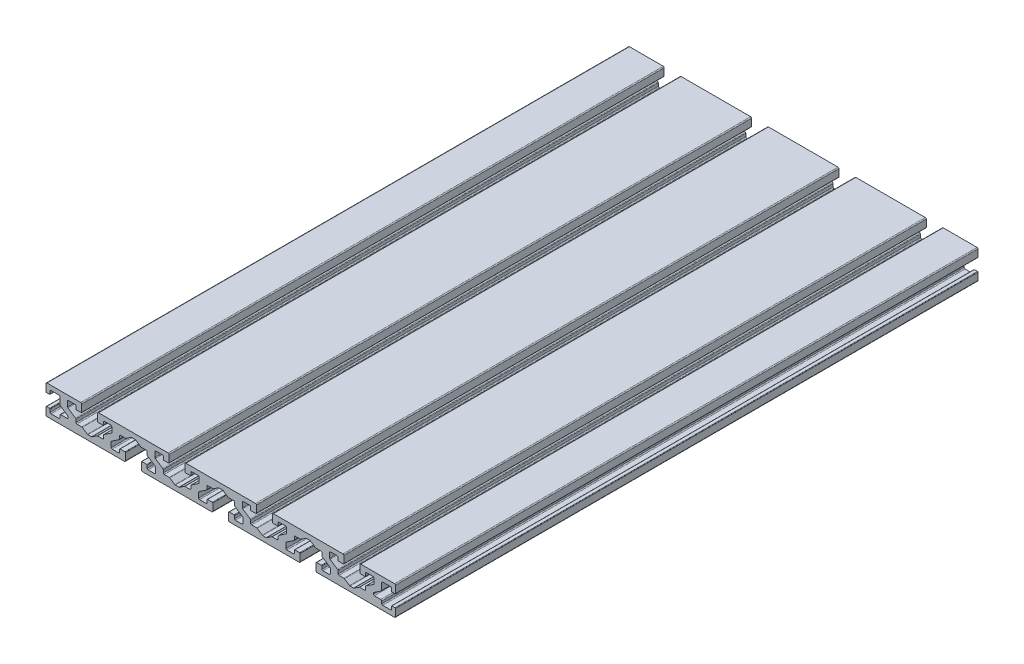
from build123d import *

# Parameters (mm, degrees)
BOSS_EXTRUDE1_DEPTH = 300


with BuildPart() as part:
    # Sketch1 → Boss-Extrude1 (new body)
    with BuildSketch(Plane.XY):
        with BuildLine():
            Line((0.5, 0), (40.4, 0))
            ThreePointArc((40.4, 0), (40.753553391, 0.146446609), (40.9, 0.5))
            Line((40.9, 0.5), (40.9, 4.15))
            ThreePointArc((40.9, 4.15), (40.826776695, 4.326776695), (40.65, 4.4))
            Line((40.65, 4.4), (38.15, 4.4))
            ThreePointArc((38.15, 4.4), (37.973223305, 4.326776695), (37.9, 4.15))
            Line((37.9, 4.15), (37.9, 2.8))
            ThreePointArc((37.9, 2.8), (37.753553391, 2.446446609), (37.4, 2.3))
            Line((37.4, 2.3), (34.1, 2.3))
            ThreePointArc((34.1, 2.3), (33.746446609, 2.446446609), (33.6, 2.8))
            Line((33.6, 2.8), (33.6, 5.329632483))
            ThreePointArc((33.6, 5.329632483), (33.659162701, 5.565561446), (33.822649902, 5.74565763))
            Line((33.822649902, 5.74565763), (37.677350098, 8.315457761))
            ThreePointArc((37.677350098, 8.315457761), (37.840837299, 8.495553945), (37.9, 8.731482908))
            Line((37.9, 8.731482908), (37.9, 10.1))
            ThreePointArc((37.9, 10.1), (38.046446609, 10.453553391), (38.4, 10.6))
            Line((38.4, 10.6), (40.952775638, 10.6))
            ThreePointArc((40.952775638, 10.6), (41.097667712, 10.621453987), (41.230125736, 10.683974853))
            Line((41.230125736, 10.683974853), (43.828201177, 12.416025147))
            ThreePointArc((43.828201177, 12.416025147), (43.960659201, 12.478546013), (44.105551275, 12.5))
            Line((44.105551275, 12.5), (45.894448725, 12.5))
            ThreePointArc((45.894448725, 12.5), (46.039340799, 12.478546013), (46.171798823, 12.416025147))
            Line((46.171798823, 12.416025147), (48.769874264, 10.683974853))
            ThreePointArc((48.769874264, 10.683974853), (48.902332288, 10.621453987), (49.047224362, 10.6))
            Line((49.047224362, 10.6), (51.6, 10.6))
            ThreePointArc((51.6, 10.6), (51.953553391, 10.453553391), (52.1, 10.1))
            Line((52.1, 10.1), (52.1, 8.731482908))
            ThreePointArc((52.1, 8.731482908), (52.159162701, 8.495553945), (52.322649902, 8.315457761))
            Line((52.322649902, 8.315457761), (56.177350098, 5.74565763))
            ThreePointArc((56.177350098, 5.74565763), (56.340837299, 5.565561446), (56.4, 5.329632483))
            Line((56.4, 5.329632483), (56.4, 2.8))
            ThreePointArc((56.4, 2.8), (56.253553391, 2.446446609), (55.9, 2.3))
            Line((55.9, 2.3), (52.6, 2.3))
            ThreePointArc((52.6, 2.3), (52.246446609, 2.446446609), (52.1, 2.8))
            Line((52.1, 2.8), (52.1, 4.15))
            ThreePointArc((52.1, 4.15), (52.026776695, 4.326776695), (51.85, 4.4))
            Line((51.85, 4.4), (49.35, 4.4))
            ThreePointArc((49.35, 4.4), (49.173223305, 4.326776695), (49.1, 4.15))
            Line((49.1, 4.15), (49.1, 0.5))
            ThreePointArc((49.1, 0.5), (49.246446609, 0.146446609), (49.6, 0))
            Line((49.6, 0), (85.4, 0))
            ThreePointArc((85.4, 0), (85.753553391, 0.146446609), (85.9, 0.5))
            Line((85.9, 0.5), (85.9, 4.15))
            ThreePointArc((85.9, 4.15), (85.826776695, 4.326776695), (85.65, 4.4))
            Line((85.65, 4.4), (83.15, 4.4))
            ThreePointArc((83.15, 4.4), (82.973223305, 4.326776695), (82.9, 4.15))
            Line((82.9, 4.15), (82.9, 2.8))
            ThreePointArc((82.9, 2.8), (82.753553391, 2.446446609), (82.4, 2.3))
            Line((82.4, 2.3), (79.1, 2.3))
            ThreePointArc((79.1, 2.3), (78.746446609, 2.446446609), (78.6, 2.8))
            Line((78.6, 2.8), (78.6, 5.329632483))
            ThreePointArc((78.6, 5.329632483), (78.659162701, 5.565561446), (78.822649902, 5.74565763))
            Line((78.822649902, 5.74565763), (82.677350098, 8.315457761))
            ThreePointArc((82.677350098, 8.315457761), (82.840837299, 8.495553945), (82.9, 8.731482908))
            Line((82.9, 8.731482908), (82.9, 10.1))
            ThreePointArc((82.9, 10.1), (83.046446609, 10.453553391), (83.4, 10.6))
            Line((83.4, 10.6), (85.952775638, 10.6))
            ThreePointArc((85.952775638, 10.6), (86.097667712, 10.621453987), (86.230125736, 10.683974853))
            Line((86.230125736, 10.683974853), (88.828201177, 12.416025147))
            ThreePointArc((88.828201177, 12.416025147), (88.960659201, 12.478546013), (89.105551275, 12.5))
            Line((89.105551275, 12.5), (90.894448725, 12.5))
            ThreePointArc((90.894448725, 12.5), (91.039340799, 12.478546013), (91.171798823, 12.416025147))
            Line((91.171798823, 12.416025147), (93.769874264, 10.683974853))
            ThreePointArc((93.769874264, 10.683974853), (93.902332288, 10.621453987), (94.047224362, 10.6))
            Line((94.047224362, 10.6), (96.6, 10.6))
            ThreePointArc((96.6, 10.6), (96.953553391, 10.453553391), (97.1, 10.1))
            Line((97.1, 10.1), (97.1, 8.731482908))
            ThreePointArc((97.1, 8.731482908), (97.159162701, 8.495553945), (97.322649902, 8.315457761))
            Line((97.322649902, 8.315457761), (101.177350098, 5.74565763))
            ThreePointArc((101.177350098, 5.74565763), (101.340837299, 5.565561446), (101.4, 5.329632483))
            Line((101.4, 5.329632483), (101.4, 2.8))
            ThreePointArc((101.4, 2.8), (101.253553391, 2.446446609), (100.9, 2.3))
            Line((100.9, 2.3), (97.6, 2.3))
            ThreePointArc((97.6, 2.3), (97.246446609, 2.446446609), (97.1, 2.8))
            Line((97.1, 2.8), (97.1, 4.15))
            ThreePointArc((97.1, 4.15), (97.026776695, 4.326776695), (96.85, 4.4))
            Line((96.85, 4.4), (94.35, 4.4))
            ThreePointArc((94.35, 4.4), (94.173223305, 4.326776695), (94.1, 4.15))
            Line((94.1, 4.15), (94.1, 0.5))
            ThreePointArc((94.1, 0.5), (94.246446609, 0.146446609), (94.6, 0))
            Line((94.6, 0), (130.4, 0))
            ThreePointArc((130.4, 0), (130.753553391, 0.146446609), (130.9, 0.5))
            Line((130.9, 0.5), (130.9, 4.15))
            ThreePointArc((130.9, 4.15), (130.826776695, 4.326776695), (130.65, 4.4))
            Line((130.65, 4.4), (128.15, 4.4))
            ThreePointArc((128.15, 4.4), (127.973223305, 4.326776695), (127.9, 4.15))
            Line((127.9, 4.15), (127.9, 2.8))
            ThreePointArc((127.9, 2.8), (127.753553391, 2.446446609), (127.4, 2.3))
            Line((127.4, 2.3), (124.1, 2.3))
            ThreePointArc((124.1, 2.3), (123.746446609, 2.446446609), (123.6, 2.8))
            Line((123.6, 2.8), (123.6, 5.329632483))
            ThreePointArc((123.6, 5.329632483), (123.659162701, 5.565561446), (123.822649902, 5.74565763))
            Line((123.822649902, 5.74565763), (127.677350098, 8.315457761))
            ThreePointArc((127.677350098, 8.315457761), (127.840837299, 8.495553945), (127.9, 8.731482908))
            Line((127.9, 8.731482908), (127.9, 10.1))
            ThreePointArc((127.9, 10.1), (128.046446609, 10.453553391), (128.4, 10.6))
            Line((128.4, 10.6), (130.952775638, 10.6))
            ThreePointArc((130.952775638, 10.6), (131.097667712, 10.621453987), (131.230125736, 10.683974853))
            Line((131.230125736, 10.683974853), (133.828201177, 12.416025147))
            ThreePointArc((133.828201177, 12.416025147), (133.960659201, 12.478546013), (134.105551275, 12.5))
            Line((134.105551275, 12.5), (135.894448725, 12.5))
            ThreePointArc((135.894448725, 12.5), (136.039340799, 12.478546013), (136.171798823, 12.416025147))
            Line((136.171798823, 12.416025147), (138.769874264, 10.683974853))
            ThreePointArc((138.769874264, 10.683974853), (138.902332288, 10.621453987), (139.047224362, 10.6))
            Line((139.047224362, 10.6), (141.6, 10.6))
            ThreePointArc((141.6, 10.6), (141.953553391, 10.453553391), (142.1, 10.1))
            Line((142.1, 10.1), (142.1, 8.731482908))
            ThreePointArc((142.1, 8.731482908), (142.159162701, 8.495553945), (142.322649902, 8.315457761))
            Line((142.322649902, 8.315457761), (146.177350098, 5.74565763))
            ThreePointArc((146.177350098, 5.74565763), (146.340837299, 5.565561446), (146.4, 5.329632483))
            Line((146.4, 5.329632483), (146.4, 2.8))
            ThreePointArc((146.4, 2.8), (146.253553391, 2.446446609), (145.9, 2.3))
            Line((145.9, 2.3), (142.6, 2.3))
            ThreePointArc((142.6, 2.3), (142.246446609, 2.446446609), (142.1, 2.8))
            Line((142.1, 2.8), (142.1, 4.15))
            ThreePointArc((142.1, 4.15), (142.026776695, 4.326776695), (141.85, 4.4))
            Line((141.85, 4.4), (139.35, 4.4))
            ThreePointArc((139.35, 4.4), (139.173223305, 4.326776695), (139.1, 4.15))
            Line((139.1, 4.15), (139.1, 0.5))
            ThreePointArc((139.1, 0.5), (139.246446609, 0.146446609), (139.6, 0))
            Line((139.6, 0), (179.5, 0))
            ThreePointArc((179.5, 0), (179.853553391, 0.146446609), (180, 0.5))
            Line((180, 0.5), (180, 4.15))
            ThreePointArc((180, 4.15), (179.926776695, 4.326776695), (179.75, 4.4))
            Line((179.75, 4.4), (178.15, 4.4))
            ThreePointArc((178.15, 4.4), (177.973223305, 4.326776695), (177.9, 4.15))
            Line((177.9, 4.15), (177.9, 2.8))
            ThreePointArc((177.9, 2.8), (177.753553391, 2.446446609), (177.4, 2.3))
            Line((177.4, 2.3), (173.4, 2.3))
            ThreePointArc((173.4, 2.3), (173.046446609, 2.446446609), (172.9, 2.8))
            Line((172.9, 2.8), (172.9, 3.9))
            ThreePointArc((172.9, 3.9), (172.753553391, 4.253553391), (172.4, 4.4))
            Line((172.4, 4.4), (169.1, 4.4))
            ThreePointArc((169.1, 4.4), (168.746446609, 4.546446609), (168.6, 4.9))
            Line((168.6, 4.9), (168.6, 5.329632483))
            ThreePointArc((168.6, 5.329632483), (168.659162701, 5.565561446), (168.822649902, 5.74565763))
            Line((168.822649902, 5.74565763), (172.677350098, 8.315457761))
            ThreePointArc((172.677350098, 8.315457761), (172.840837299, 8.495553945), (172.9, 8.731482908))
            Line((172.9, 8.731482908), (172.9, 12.2))
            ThreePointArc((172.9, 12.2), (173.046446609, 12.553553391), (173.4, 12.7))
            Line((173.4, 12.7), (177.4, 12.7))
            ThreePointArc((177.4, 12.7), (177.753553391, 12.553553391), (177.9, 12.2))
            Line((177.9, 12.2), (177.9, 10.85))
            ThreePointArc((177.9, 10.85), (177.973223305, 10.673223305), (178.15, 10.6))
            Line((178.15, 10.6), (179.75, 10.6))
            ThreePointArc((179.75, 10.6), (179.926776695, 10.673223305), (180, 10.85))
            Line((180, 10.85), (180, 14.5))
            ThreePointArc((180, 14.5), (179.853553391, 14.853553391), (179.5, 15))
            Line((179.5, 15), (162.1, 15))
            ThreePointArc((162.1, 15), (161.746446609, 14.853553391), (161.6, 14.5))
            Line((161.6, 14.5), (161.6, 10.85))
            ThreePointArc((161.6, 10.85), (161.673223305, 10.673223305), (161.85, 10.6))
            Line((161.85, 10.6), (164.35, 10.6))
            ThreePointArc((164.35, 10.6), (164.526776695, 10.673223305), (164.6, 10.85))
            Line((164.6, 10.85), (164.6, 12.2))
            ThreePointArc((164.6, 12.2), (164.746446609, 12.553553391), (165.1, 12.7))
            Line((165.1, 12.7), (168.4, 12.7))
            ThreePointArc((168.4, 12.7), (168.753553391, 12.553553391), (168.9, 12.2))
            Line((168.9, 12.2), (168.9, 9.670367517))
            ThreePointArc((168.9, 9.670367517), (168.840837299, 9.434438554), (168.677350098, 9.25434237))
            Line((168.677350098, 9.25434237), (164.822649902, 6.684542239))
            ThreePointArc((164.822649902, 6.684542239), (164.659162701, 6.504446055), (164.6, 6.268517092))
            Line((164.6, 6.268517092), (164.6, 4.9))
            ThreePointArc((164.6, 4.9), (164.453553391, 4.546446609), (164.1, 4.4))
            Line((164.1, 4.4), (161.547224362, 4.4))
            ThreePointArc((161.547224362, 4.4), (161.402332288, 4.378546013), (161.269874264, 4.316025147))
            Line((161.269874264, 4.316025147), (158.671798823, 2.583974853))
            ThreePointArc((158.671798823, 2.583974853), (158.539340799, 2.521453987), (158.394448725, 2.5))
            Line((158.394448725, 2.5), (156.605551275, 2.5))
            ThreePointArc((156.605551275, 2.5), (156.460659201, 2.521453987), (156.328201177, 2.583974853))
            Line((156.328201177, 2.583974853), (153.730125736, 4.316025147))
            ThreePointArc((153.730125736, 4.316025147), (153.597667712, 4.378546013), (153.452775638, 4.4))
            Line((153.452775638, 4.4), (150.9, 4.4))
            ThreePointArc((150.9, 4.4), (150.546446609, 4.546446609), (150.4, 4.9))
            Line((150.4, 4.9), (150.4, 6.268517092))
            ThreePointArc((150.4, 6.268517092), (150.340837299, 6.504446055), (150.177350098, 6.684542239))
            Line((150.177350098, 6.684542239), (146.322649902, 9.25434237))
            ThreePointArc((146.322649902, 9.25434237), (146.159162701, 9.434438554), (146.1, 9.670367517))
            Line((146.1, 9.670367517), (146.1, 12.2))
            ThreePointArc((146.1, 12.2), (146.246446609, 12.553553391), (146.6, 12.7))
            Line((146.6, 12.7), (149.9, 12.7))
            ThreePointArc((149.9, 12.7), (150.253553391, 12.553553391), (150.4, 12.2))
            Line((150.4, 12.2), (150.4, 10.85))
            ThreePointArc((150.4, 10.85), (150.473223305, 10.673223305), (150.65, 10.6))
            Line((150.65, 10.6), (153.15, 10.6))
            ThreePointArc((153.15, 10.6), (153.326776695, 10.673223305), (153.4, 10.85))
            Line((153.4, 10.85), (153.4, 14.5))
            ThreePointArc((153.4, 14.5), (153.253553391, 14.853553391), (152.9, 15))
            Line((152.9, 15), (117.1, 15))
            ThreePointArc((117.1, 15), (116.746446609, 14.853553391), (116.6, 14.5))
            Line((116.6, 14.5), (116.6, 10.85))
            ThreePointArc((116.6, 10.85), (116.673223305, 10.673223305), (116.85, 10.6))
            Line((116.85, 10.6), (119.35, 10.6))
            ThreePointArc((119.35, 10.6), (119.526776695, 10.673223305), (119.6, 10.85))
            Line((119.6, 10.85), (119.6, 12.2))
            ThreePointArc((119.6, 12.2), (119.746446609, 12.553553391), (120.1, 12.7))
            Line((120.1, 12.7), (123.4, 12.7))
            ThreePointArc((123.4, 12.7), (123.753553391, 12.553553391), (123.9, 12.2))
            Line((123.9, 12.2), (123.9, 9.670367517))
            ThreePointArc((123.9, 9.670367517), (123.840837299, 9.434438554), (123.677350098, 9.25434237))
            Line((123.677350098, 9.25434237), (119.822649902, 6.684542239))
            ThreePointArc((119.822649902, 6.684542239), (119.659162701, 6.504446055), (119.6, 6.268517092))
            Line((119.6, 6.268517092), (119.6, 4.9))
            ThreePointArc((119.6, 4.9), (119.453553391, 4.546446609), (119.1, 4.4))
            Line((119.1, 4.4), (116.547224362, 4.4))
            ThreePointArc((116.547224362, 4.4), (116.402332288, 4.378546013), (116.269874264, 4.316025147))
            Line((116.269874264, 4.316025147), (113.671798823, 2.583974853))
            ThreePointArc((113.671798823, 2.583974853), (113.539340799, 2.521453987), (113.394448725, 2.5))
            Line((113.394448725, 2.5), (111.605551275, 2.5))
            ThreePointArc((111.605551275, 2.5), (111.460659201, 2.521453987), (111.328201177, 2.583974853))
            Line((111.328201177, 2.583974853), (108.730125736, 4.316025147))
            ThreePointArc((108.730125736, 4.316025147), (108.597667712, 4.378546013), (108.452775638, 4.4))
            Line((108.452775638, 4.4), (105.9, 4.4))
            ThreePointArc((105.9, 4.4), (105.546446609, 4.546446609), (105.4, 4.9))
            Line((105.4, 4.9), (105.4, 6.268517092))
            ThreePointArc((105.4, 6.268517092), (105.340837299, 6.504446055), (105.177350098, 6.684542239))
            Line((105.177350098, 6.684542239), (101.322649902, 9.25434237))
            ThreePointArc((101.322649902, 9.25434237), (101.159162701, 9.434438554), (101.1, 9.670367517))
            Line((101.1, 9.670367517), (101.1, 12.2))
            ThreePointArc((101.1, 12.2), (101.246446609, 12.553553391), (101.6, 12.7))
            Line((101.6, 12.7), (104.9, 12.7))
            ThreePointArc((104.9, 12.7), (105.253553391, 12.553553391), (105.4, 12.2))
            Line((105.4, 12.2), (105.4, 10.85))
            ThreePointArc((105.4, 10.85), (105.473223305, 10.673223305), (105.65, 10.6))
            Line((105.65, 10.6), (108.15, 10.6))
            ThreePointArc((108.15, 10.6), (108.326776695, 10.673223305), (108.4, 10.85))
            Line((108.4, 10.85), (108.4, 14.5))
            ThreePointArc((108.4, 14.5), (108.253553391, 14.853553391), (107.9, 15))
            Line((107.9, 15), (72.1, 15))
            ThreePointArc((72.1, 15), (71.746446609, 14.853553391), (71.6, 14.5))
            Line((71.6, 14.5), (71.6, 10.85))
            ThreePointArc((71.6, 10.85), (71.673223305, 10.673223305), (71.85, 10.6))
            Line((71.85, 10.6), (74.35, 10.6))
            ThreePointArc((74.35, 10.6), (74.526776695, 10.673223305), (74.6, 10.85))
            Line((74.6, 10.85), (74.6, 12.2))
            ThreePointArc((74.6, 12.2), (74.746446609, 12.553553391), (75.1, 12.7))
            Line((75.1, 12.7), (78.4, 12.7))
            ThreePointArc((78.4, 12.7), (78.753553391, 12.553553391), (78.9, 12.2))
            Line((78.9, 12.2), (78.9, 9.670367517))
            ThreePointArc((78.9, 9.670367517), (78.840837299, 9.434438554), (78.677350098, 9.25434237))
            Line((78.677350098, 9.25434237), (74.822649902, 6.684542239))
            ThreePointArc((74.822649902, 6.684542239), (74.659162701, 6.504446055), (74.6, 6.268517092))
            Line((74.6, 6.268517092), (74.6, 4.9))
            ThreePointArc((74.6, 4.9), (74.453553391, 4.546446609), (74.1, 4.4))
            Line((74.1, 4.4), (71.547224362, 4.4))
            ThreePointArc((71.547224362, 4.4), (71.402332288, 4.378546013), (71.269874264, 4.316025147))
            Line((71.269874264, 4.316025147), (68.671798823, 2.583974853))
            ThreePointArc((68.671798823, 2.583974853), (68.539340799, 2.521453987), (68.394448725, 2.5))
            Line((68.394448725, 2.5), (66.605551275, 2.5))
            ThreePointArc((66.605551275, 2.5), (66.460659201, 2.521453987), (66.328201177, 2.583974853))
            Line((66.328201177, 2.583974853), (63.730125736, 4.316025147))
            ThreePointArc((63.730125736, 4.316025147), (63.597667712, 4.378546013), (63.452775638, 4.4))
            Line((63.452775638, 4.4), (60.9, 4.4))
            ThreePointArc((60.9, 4.4), (60.546446609, 4.546446609), (60.4, 4.9))
            Line((60.4, 4.9), (60.4, 6.268517092))
            ThreePointArc((60.4, 6.268517092), (60.340837299, 6.504446055), (60.177350098, 6.684542239))
            Line((60.177350098, 6.684542239), (56.322649902, 9.25434237))
            ThreePointArc((56.322649902, 9.25434237), (56.159162701, 9.434438554), (56.1, 9.670367517))
            Line((56.1, 9.670367517), (56.1, 12.2))
            ThreePointArc((56.1, 12.2), (56.246446609, 12.553553391), (56.6, 12.7))
            Line((56.6, 12.7), (59.9, 12.7))
            ThreePointArc((59.9, 12.7), (60.253553391, 12.553553391), (60.4, 12.2))
            Line((60.4, 12.2), (60.4, 10.85))
            ThreePointArc((60.4, 10.85), (60.473223305, 10.673223305), (60.65, 10.6))
            Line((60.65, 10.6), (63.15, 10.6))
            ThreePointArc((63.15, 10.6), (63.326776695, 10.673223305), (63.4, 10.85))
            Line((63.4, 10.85), (63.4, 14.5))
            ThreePointArc((63.4, 14.5), (63.253553391, 14.853553391), (62.9, 15))
            Line((62.9, 15), (27.1, 15))
            ThreePointArc((27.1, 15), (26.746446609, 14.853553391), (26.6, 14.5))
            Line((26.6, 14.5), (26.6, 10.85))
            ThreePointArc((26.6, 10.85), (26.673223305, 10.673223305), (26.85, 10.6))
            Line((26.85, 10.6), (29.35, 10.6))
            ThreePointArc((29.35, 10.6), (29.526776695, 10.673223305), (29.6, 10.85))
            Line((29.6, 10.85), (29.6, 12.2))
            ThreePointArc((29.6, 12.2), (29.746446609, 12.553553391), (30.1, 12.7))
            Line((30.1, 12.7), (33.4, 12.7))
            ThreePointArc((33.4, 12.7), (33.753553391, 12.553553391), (33.9, 12.2))
            Line((33.9, 12.2), (33.9, 9.670367517))
            ThreePointArc((33.9, 9.670367517), (33.840837299, 9.434438554), (33.677350098, 9.25434237))
            Line((33.677350098, 9.25434237), (29.822649902, 6.684542239))
            ThreePointArc((29.822649902, 6.684542239), (29.659162701, 6.504446055), (29.6, 6.268517092))
            Line((29.6, 6.268517092), (29.6, 4.9))
            ThreePointArc((29.6, 4.9), (29.453553391, 4.546446609), (29.1, 4.4))
            Line((29.1, 4.4), (26.547224362, 4.4))
            ThreePointArc((26.547224362, 4.4), (26.402332288, 4.378546013), (26.269874264, 4.316025147))
            Line((26.269874264, 4.316025147), (23.671798823, 2.583974853))
            ThreePointArc((23.671798823, 2.583974853), (23.539340799, 2.521453987), (23.394448725, 2.5))
            Line((23.394448725, 2.5), (21.605551275, 2.5))
            ThreePointArc((21.605551275, 2.5), (21.460659201, 2.521453987), (21.328201177, 2.583974853))
            Line((21.328201177, 2.583974853), (18.730125736, 4.316025147))
            ThreePointArc((18.730125736, 4.316025147), (18.597667712, 4.378546013), (18.452775638, 4.4))
            Line((18.452775638, 4.4), (15.9, 4.4))
            ThreePointArc((15.9, 4.4), (15.546446609, 4.546446609), (15.4, 4.9))
            Line((15.4, 4.9), (15.4, 6.268517092))
            ThreePointArc((15.4, 6.268517092), (15.340837299, 6.504446055), (15.177350098, 6.684542239))
            Line((15.177350098, 6.684542239), (11.322649902, 9.25434237))
            ThreePointArc((11.322649902, 9.25434237), (11.159162701, 9.434438554), (11.1, 9.670367517))
            Line((11.1, 9.670367517), (11.1, 12.2))
            ThreePointArc((11.1, 12.2), (11.246446609, 12.553553391), (11.6, 12.7))
            Line((11.6, 12.7), (14.9, 12.7))
            ThreePointArc((14.9, 12.7), (15.253553391, 12.553553391), (15.4, 12.2))
            Line((15.4, 12.2), (15.4, 10.85))
            ThreePointArc((15.4, 10.85), (15.473223305, 10.673223305), (15.65, 10.6))
            Line((15.65, 10.6), (18.15, 10.6))
            ThreePointArc((18.15, 10.6), (18.326776695, 10.673223305), (18.4, 10.85))
            Line((18.4, 10.85), (18.4, 14.5))
            ThreePointArc((18.4, 14.5), (18.253553391, 14.853553391), (17.9, 15))
            Line((17.9, 15), (0.5, 15))
            ThreePointArc((0.5, 15), (0.146446609, 14.853553391), (0, 14.5))
            Line((0, 14.5), (0, 10.85))
            ThreePointArc((0, 10.85), (0.073223305, 10.673223305), (0.25, 10.6))
            Line((0.25, 10.6), (1.85, 10.6))
            ThreePointArc((1.85, 10.6), (2.026776695, 10.673223305), (2.1, 10.85))
            Line((2.1, 10.85), (2.1, 12.2))
            ThreePointArc((2.1, 12.2), (2.246446609, 12.553553391), (2.6, 12.7))
            Line((2.6, 12.7), (6.6, 12.7))
            ThreePointArc((6.6, 12.7), (6.953553391, 12.553553391), (7.1, 12.2))
            Line((7.1, 12.2), (7.1, 8.731482908))
            ThreePointArc((7.1, 8.731482908), (7.159162701, 8.495553945), (7.322649902, 8.315457761))
            Line((7.322649902, 8.315457761), (11.177350098, 5.74565763))
            ThreePointArc((11.177350098, 5.74565763), (11.340837299, 5.565561446), (11.4, 5.329632483))
            Line((11.4, 5.329632483), (11.4, 4.9))
            ThreePointArc((11.4, 4.9), (11.253553391, 4.546446609), (10.9, 4.4))
            Line((10.9, 4.4), (7.6, 4.4))
            ThreePointArc((7.6, 4.4), (7.246446609, 4.253553391), (7.1, 3.9))
            Line((7.1, 3.9), (7.1, 2.8))
            ThreePointArc((7.1, 2.8), (6.953553391, 2.446446609), (6.6, 2.3))
            Line((6.6, 2.3), (2.6, 2.3))
            ThreePointArc((2.6, 2.3), (2.246446609, 2.446446609), (2.1, 2.8))
            Line((2.1, 2.8), (2.1, 4.15))
            ThreePointArc((2.1, 4.15), (2.026776695, 4.326776695), (1.85, 4.4))
            Line((1.85, 4.4), (0.25, 4.4))
            ThreePointArc((0.25, 4.4), (0.073223305, 4.326776695), (0, 4.15))
            Line((0, 4.15), (0, 0.5))
            ThreePointArc((0, 0.5), (0.146446609, 0.146446609), (0.5, 0))
        make_face()
    extrude(amount=BOSS_EXTRUDE1_DEPTH)


solid = part.part
